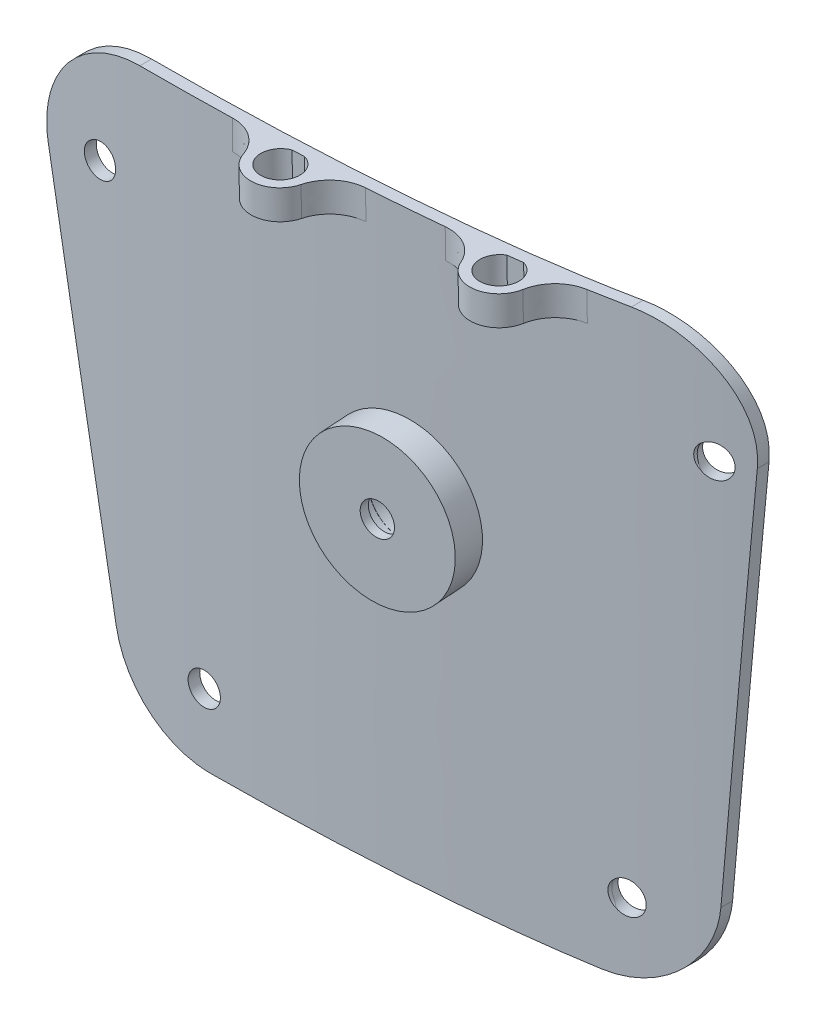
from build123d import *

# Parameters (mm, degrees)
BOSS_EXTRUDE1_DEPTH      = 20
FILLET1_R                = 10
CUT_EXTRUDE1_DEPTH       = 100
CUT_EXTRUDE1_DEPTH_BACK  = 100
CUT_EXTRUDE4_DEPTH       = 25
CUT_EXTRUDE4_DEPTH_BACK  = 10
SKETCH3_R                = 1.55
CUT_EXTRUDE6_DEPTH       = 10
CUT_EXTRUDE6_DEPTH_BACK  = 10
SKETCH6_R                = 1.65
CUT_EXTRUDE7_DEPTH       = 10
CUT_EXTRUDE7_DEPTH_BACK  = 10
SKETCH7_R                = 1.65
CUT_EXTRUDE8_DEPTH       = 10
CUT_EXTRUDE8_DEPTH_BACK  = 10
SKETCH8_R                = 1.65
CUT_EXTRUDE9_DEPTH       = 10
CUT_EXTRUDE9_DEPTH_BACK  = 10
SKETCH9_R                = 1.65
CUT_EXTRUDE10_DEPTH      = 10
CUT_EXTRUDE10_DEPTH_BACK = 10
SKETCH10_R               = 1.65
SKETCH11_R               = 7.5
SKETCH11_R_2             = 1.65
BOSS_EXTRUDE5_DEPTH      = 3
SKETCH12_R               = 3.502284732
CUT_EXTRUDE11_DEPTH      = 3.5
SKETCH16_R               = 3
SKETCH16_R_2             = 2
BOSS_EXTRUDE6_DEPTH      = 3
FILLET5_R                = 4


with BuildPart() as part:
    # Sketch1 → Boss-Extrude1 (new body)
    with BuildSketch(Plane.XY):
        Polygon((8.480028905, 36.364162969), (19.360902256, -22.640977444), (74.360902256, -22.640977444), (78.472958937, 37.359022556), align=None)
    extrude(amount=BOSS_EXTRUDE1_DEPTH)

    # Fillet1
    fillet1_edges = [part.edges().sort_by_distance(p)[0] for p in [
        (74.360902256, -22.640977444, 10),
        (19.360902256, -22.640977444, 10),
        (8.480028905, 36.364162969, 10),
        (78.472958937, 37.359022556, 10),
    ]]
    fillet(fillet1_edges, radius=FILLET1_R)

    # Sketch2 → Cut-Extrude1 (cut, two sides: drawn at the far end of the back side and taken through both)
    with BuildSketch(Plane(origin=(0, 0, 0), x_dir=(1, 0, 0), z_dir=(0, 1, 0)).offset(-CUT_EXTRUDE1_DEPTH_BACK)):
        Polygon((-34.439432477, 11.630216334), (-34.439432477, -22.926204047), (85.315807502, -26.767134305), (85.315807502, 11.630216334), align=None)
        with BuildLine():
            add(Edge.make_bspline(
                [(-29.855816864, -9.239413225), (-29.855816864, -18.784022849), (27.570578004, -18.473949578), (84.996972871, -18.163876308), (81.265779923, -8.639413225)],
                knots=[0, 0, 0, 1.603288786, 1.603288786, 3.206577572, 3.206577572, 3.206577572], degree=2, weights=[1, 0.695526153, 1, 0.695526153, 1]))
            add(Edge.make_bspline(
                [(-29.738416516, -8.639413225), (-29.855816864, -8.939096274), (-29.855816864, -9.239413225)],
                knots=[6.218200389, 6.218200389, 6.218200389, 6.283185307, 6.283185307, 6.283185307], degree=2, weights=[1, 0.999472166, 1]))
            add(Edge.make_bspline(
                [(-29.738416516, -8.639413225), (-26.353940413, -17.27882645), (25.763681703, -17.27882645), (77.88130382, -17.27882645), (81.265779923, -8.639413225)],
                knots=[0.064984918, 0.064984918, 0.064984918, 1.570796327, 1.570796327, 3.076607735, 3.076607735, 3.076607735], degree=2, weights=[1, 0.729705142, 1, 0.729705142, 1]))
        make_face(mode=Mode.SUBTRACT)
    extrude(amount=CUT_EXTRUDE1_DEPTH + CUT_EXTRUDE1_DEPTH_BACK, mode=Mode.SUBTRACT)

    # Sketch3 → Cut-Extrude4 (cut, two sides: drawn at the far end of the back side and taken through both)
    with BuildSketch(Plane.XY.offset(-CUT_EXTRUDE4_DEPTH_BACK)):
        with Locations((16.216885375, 26.155587251)):
            Circle(SKETCH3_R)
        with Locations((74.386282507, 26.155587251)):
            Circle(SKETCH3_R)
        with Locations((46.83646973, 10.811243215)):
            Circle(SKETCH3_R)
        with Locations((27.022046053, -15.396700442)):
            Circle(SKETCH3_R)
        with Locations((67.117888375, -15.396700442)):
            Circle(SKETCH3_R)
    extrude(amount=CUT_EXTRUDE4_DEPTH + CUT_EXTRUDE4_DEPTH_BACK, mode=Mode.SUBTRACT)

    # Sketch6 → Cut-Extrude6 (cut, two sides: drawn at the far end of the back side and taken through both)
    with BuildSketch(Plane(origin=(-0.434189407, -0.02532877, 15.636095985), x_dir=(0.9996146817388931, -4.267460377470012e-05, 0.02775763374154417), z_dir=(-0.027757666451138998, -0.0016192646033559705, 0.9996133702263749)).offset(-CUT_EXTRUDE6_DEPTH_BACK)):
        with Locations((16.631434418, 25.996715933)):
            Circle(SKETCH6_R)
    extrude(amount=CUT_EXTRUDE6_DEPTH + CUT_EXTRUDE6_DEPTH_BACK, mode=Mode.SUBTRACT)

    # Sketch7 → Cut-Extrude7 (cut, two sides: drawn at the far end of the back side and taken through both)
    with BuildSketch(Plane(origin=(1.442680004, 0.036490093, 20.936154169), x_dir=(-0.9976342349499691, 0.00012752404454944926, 0.06874530524630935), z_dir=(-0.06874542309626006, -0.0017387964383983705, -0.9976327196870911)).offset(-CUT_EXTRUDE7_DEPTH_BACK)):
        with Locations((-45.495991738, 10.77824272)):
            Circle(SKETCH7_R)
    extrude(amount=CUT_EXTRUDE7_DEPTH + CUT_EXTRUDE7_DEPTH_BACK, mode=Mode.SUBTRACT)

    # Sketch8 → Cut-Extrude8 (cut, two sides: drawn at the far end of the back side and taken through both)
    with BuildSketch(Plane(origin=(0.117902929, -2.694e-06, 19.836473006), x_dir=(0.9999823364183166, 8.071460196158378e-10, -0.005943639572242173), z_dir=(0.005943639572242228, -1.3579756186691197e-07, 0.9999823364183075)).offset(-CUT_EXTRUDE8_DEPTH_BACK)):
        with Locations((26.85424289, -15.440225553)):
            Circle(SKETCH8_R)
    extrude(amount=CUT_EXTRUDE8_DEPTH + CUT_EXTRUDE8_DEPTH_BACK, mode=Mode.SUBTRACT)

    # Sketch9 → Cut-Extrude9 (cut, two sides: drawn at the far end of the back side and taken through both)
    with BuildSketch(Plane(origin=(4.942820891, 0.013184332, 26.867865743), x_dir=(-0.9834954907347486, 0.000749052697050044, 0.18093108805419061), z_dir=(-0.18093147327694167, -0.000482611167730129, -0.9834955867030092)).offset(-CUT_EXTRUDE9_DEPTH_BACK)):
        with Locations((-63.380681925, -15.352539894)):
            Circle(SKETCH9_R)
    extrude(amount=CUT_EXTRUDE9_DEPTH + CUT_EXTRUDE9_DEPTH_BACK, mode=Mode.SUBTRACT)

    # Sketch10 → Cut-Extrude10 (cut, two sides: drawn at the far end of the back side and taken through both)
    with BuildSketch(Plane(origin=(10.12372784, 0.537782091, 33.551090878), x_dir=(-0.9573766734033836, 0.004629187613499617, 0.28880525591669903), z_dir=(-0.28884235358248794, -0.015343581656236397, -0.9572537120737048)).offset(-CUT_EXTRUDE10_DEPTH_BACK)):
        with Locations((-67.275911857, 25.905547298)):
            Circle(SKETCH10_R)
    extrude(amount=CUT_EXTRUDE10_DEPTH + CUT_EXTRUDE10_DEPTH_BACK, mode=Mode.SUBTRACT)

    # Sketch11 → Boss-Extrude5 (add)
    with BuildSketch(Plane(origin=(1.442680004, 0.036490093, 20.936154169), x_dir=(-0.9976342349499691, 0.00012752404454944926, 0.06874530524630935), z_dir=(-0.06874542309626006, -0.0017387964383983705, -0.9976327196870911))):
        with Locations((-45.479468253, 10.769075344)):
            Circle(SKETCH11_R)
        with Locations((-45.479468253, 10.769075344)):
            Circle(SKETCH11_R_2, mode=Mode.SUBTRACT)
    extrude(amount=-BOSS_EXTRUDE5_DEPTH)

    # Sketch12 → Cut-Extrude11 (cut)
    with BuildSketch(Plane(origin=(1.346436412, 0.034055778, 19.539468362), x_dir=(0.9976342349795922, -0.00011981775749547257, -0.06874531867981117), z_dir=(0.06874542309626006, 0.0017387964383983705, 0.9976327196870911))):
        with Locations((45.479551241, 10.768724866)):
            Circle(SKETCH12_R)
    extrude(amount=CUT_EXTRUDE11_DEPTH, mode=Mode.SUBTRACT)

    # Sketch16 → Boss-Extrude6 (add)
    # profile 1 of 2: a face of its own
    with BuildSketch(Plane(origin=(-0.515052589, 36.236309441, 0), x_dir=(0.999899000450749, 0.014212279816874786, 0), z_dir=(-0.014212279816874786, 0.999899000450749, 0))):
        with Locations((57.962949227, -18.685752515)):
            Circle(SKETCH16_R)
        with Locations((57.962949227, -18.685752515)):
            Circle(SKETCH16_R_2, mode=Mode.SUBTRACT)
    # profile 2 of 2: a face of its own
    with BuildSketch(Plane(origin=(-0.515052589, 36.236309441, 0), x_dir=(0.999899000450749, 0.014212279816874786, 0), z_dir=(-0.014212279816874786, 0.999899000450749, 0))):
        with Locations((37.020581063, -20.206612845)):
            Circle(SKETCH16_R)
        with Locations((37.020581063, -20.206612845)):
            Circle(SKETCH16_R_2, mode=Mode.SUBTRACT)
    extrude(amount=-BOSS_EXTRUDE6_DEPTH)

    # Fillet5
    fillet5_edges = [part.edges().sort_by_distance(p)[0] for p in [
        (59.593276038, 35.590520896, 16.573278928),
        (54.911740767, 35.523978888, 17.108438427),
        (34.148753947, 35.228859706, 18.373226715),
        (38.773084927, 35.294588631, 18.22253112),
    ]]
    fillet(fillet5_edges, radius=FILLET5_R)


solid = part.part
